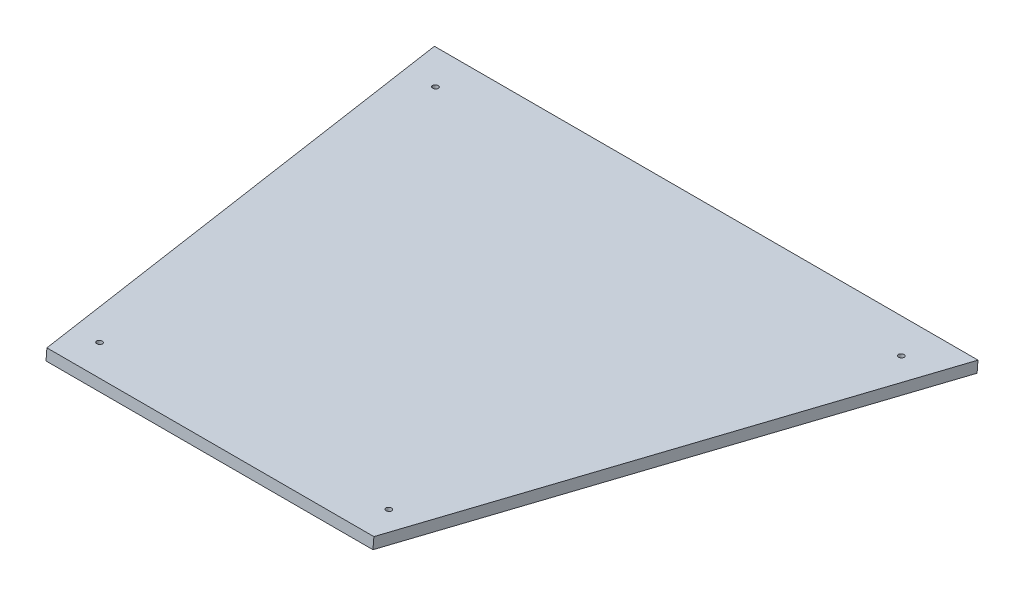
from build123d import *

# Parameters (mm, degrees)
BOSS_EXTRUDE1_DEPTH = 12.7
SKETCH2_R           = 3.175000008
CUT_EXTRUDE1_DEPTH  = 2375.892579798


with BuildPart() as part:
    # Sketch1 → Boss-Extrude1 (new body)
    with BuildSketch(Plane(origin=(-0.000803742, -10027.309671801, 827.187549866), x_dir=(-0.9999999999999969, 7.961414168714261e-08, -6.567661367452003e-09), z_dir=(-7.988457756299226e-08, -0.996614682353027, 0.08221420143970866))):
        Polygon((927.93235898, -1893.288402131), (1306.8393201, -1893.288402131), (1432.352062828, -1316.739819062), (802.419616252, -1316.739819062), align=None)
    extrude(amount=BOSS_EXTRUDE1_DEPTH)

    # Sketch2 → Cut-Extrude1 (cut, through all)
    with BuildSketch(Plane(origin=(-0.000803748, -10027.309671801, 827.187549866), x_dir=(0.9999999999999968, -7.961414422751635e-08, 6.5676468617910225e-09), z_dir=(7.988457890219468e-08, 0.9966146823530272, -0.08221420143970452))):
        with Locations((-1284.956595843, -1854.019614904)):
            Circle(SKETCH2_R)
        with Locations((-949.797461587, -1853.938669103)):
            Circle(SKETCH2_R)
        with Locations((-1387.301054821, -1360.701208826)):
            Circle(SKETCH2_R)
        with Locations((-847.470624246, -1360.701208826)):
            Circle(SKETCH2_R)
    extrude(amount=-CUT_EXTRUDE1_DEPTH, mode=Mode.SUBTRACT)


solid = part.part
